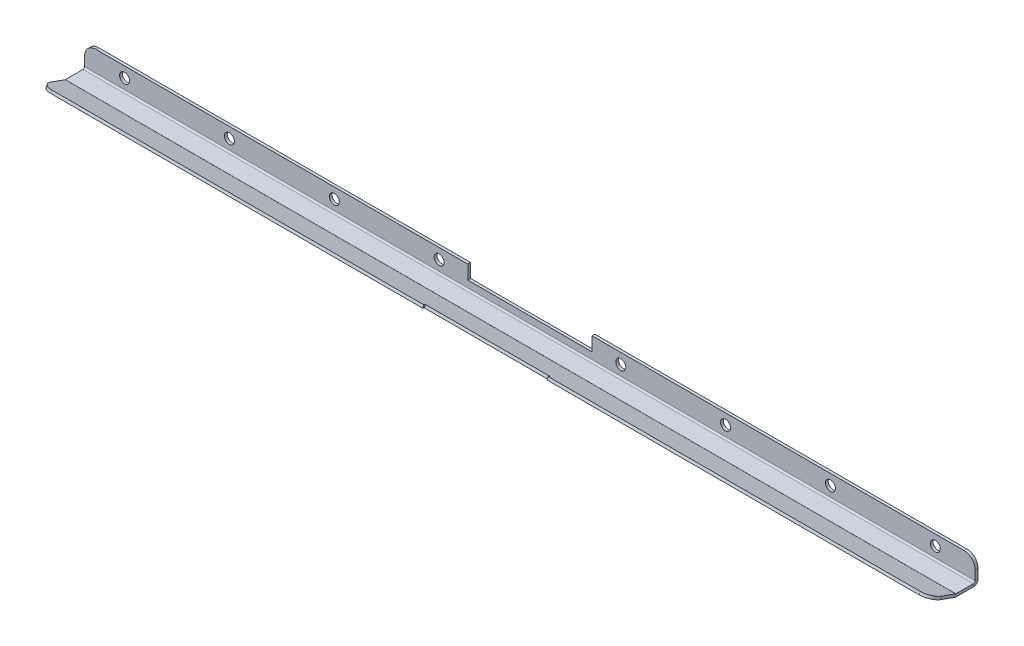
from build123d import *

# Parameters (mm, degrees)
SKETCH1_W                    = 1.25
SKETCH1_H                    = 10
BASE_FLANGE1_DEPTH           = 401
EDGE_FLANGE1_STRIP_W         = 6.4732
EDGE_FLANGE1_STRIP_H         = 1.25
EDGE_FLANGE1_STRIP_CUT_DEPTH = 401
EDGE_FLANGE1_DEPTH           = 401
EDGE_FLANGE2_STRIP_CUT_DEPTH = 401
EDGE_FLANGE2_DEPTH           = 401
CUT_EXTRUDE1_START           = 172.5
CUT_EXTRUDE1_OUTLINE_W       = 6.25
CUT_EXTRUDE1_OUTLINE_H       = 1.25
CUT_EXTRUDE1_DEPTH           = 56
SKETCH10_R                   = 2.25
CUT_EXTRUDE2_DEPTH           = 10
FILLET1_R                    = 5


# Read off the part's stored shape, not the designer's step: Cut-Extrude1
# Sheet-metal steps are written as plain solids
with BuildPart() as part:
    # Sketch1 → Base-Flange1 (new body)
    with BuildSketch(Plane(origin=(0, 0, 0), x_dir=(0, 0, -1), z_dir=(1, 0, 0))):
        with Locations((-0.625, 5)):
            Rectangle(SKETCH1_W, SKETCH1_H)
    extrude(amount=BASE_FLANGE1_DEPTH)

    # Edge-Flange1 strip (across the edge) → Edge-Flange1 strip cut (cut)
    with BuildSketch(Plane(origin=(0, 0, 1.25), x_dir=(0, 1, 0), z_dir=(1, 0, 0))):
        with Locations((-2.5, -0.625)):
            Rectangle(EDGE_FLANGE1_STRIP_W, EDGE_FLANGE1_STRIP_H)
    extrude(amount=EDGE_FLANGE1_STRIP_CUT_DEPTH, mode=Mode.SUBTRACT)

    # Edge-Flange1 section (across the edge) → Edge-Flange1 (add)
    with BuildSketch(Plane(origin=(0, 0, 1.25), x_dir=(0, 1, 0), z_dir=(1, 0, 0))):
        with BuildLine():
            Line((-1.25, 0.7366), (-1.25, 8.75))
            Line((-1.25, 8.75), (0, 8.75))
            Line((0, 8.75), (0, 0.7366))
            ThreePointArc((0, 0.7366), (0.215745145, 0.215745145), (0.7366, 0))
            Line((0.7366, 0), (0.7366, -1.25))
            ThreePointArc((0.7366, -1.25), (-0.668138332, -0.668138332), (-1.25, 0.7366))
        make_face()
    extrude(amount=EDGE_FLANGE1_DEPTH)

    # Edge-Flange2 strip (across the edge) → Edge-Flange2 strip cut (cut)
    with BuildSketch(Plane(origin=(0, 0, 10), x_dir=(0, 0.9396926207859113, -0.3420201433256607), z_dir=(1, 0, 0))):
        Polygon((-3.344158152, 5.53324351), (-1.13019336, -0.549574763), (0.044422416, -0.122049584), (-2.169542376, 5.960768689), align=None)
    extrude(amount=EDGE_FLANGE2_STRIP_CUT_DEPTH, mode=Mode.SUBTRACT)

    # Edge-Flange2 section (across the edge) → Edge-Flange2 (add)
    with BuildSketch(Plane(origin=(0, 0, 10), x_dir=(0, 0.9396926207859113, -0.3420201433256607), z_dir=(1, 0, 0))):
        with BuildLine():
            Line((-1.25, 0.129882454), (-1.25, 11.779591274))
            Line((-1.25, 11.779591274), (0, 11.779591274))
            Line((0, 11.779591274), (0, 0.129882454))
            ThreePointArc((0, 0.129882454), (0.011190609, 0.001973206), (0.044422416, -0.122049584))
            Line((0.044422416, -0.122049584), (-1.13019336, -0.549574763))
            ThreePointArc((-1.13019336, -0.549574763), (-1.219819082, -0.215087016), (-1.25, 0.129882454))
        make_face()
    extrude(amount=EDGE_FLANGE2_DEPTH)

    # Cut-Extrude1 outline → Cut-Extrude1 (cut)
    with BuildSketch(Plane.YZ.offset(CUT_EXTRUDE1_START)):
        Polygon((2.85424172, 21.496720175), (2.575384224, 20.730565502), (3.75, 20.303040323), (4.028857496, 21.069194996), align=None)
        with Locations((6.875, 0.625)):
            Rectangle(CUT_EXTRUDE1_OUTLINE_W, CUT_EXTRUDE1_OUTLINE_H)
    extrude(amount=CUT_EXTRUDE1_DEPTH, mode=Mode.SUBTRACT)

    # Sketch10 → Cut-Extrude2 (cut)
    with BuildSketch(Plane(origin=(0, 0, 0), x_dir=(-1, 0, 0), z_dir=(0, 0, -1))):
        with Locations(Location((-18, 5.25, 0), (0, 0, 90))):
            Circle(SKETCH10_R)
        with Locations(Location((-65.2, 5.25, 0), (0, 0, 90))):
            Circle(SKETCH10_R)
        with Locations(Location((-112.4, 5.25, 0), (0, 0, 90))):
            Circle(SKETCH10_R)
        with Locations(Location((-159.6, 5.25, 0), (0, 0, 90))):
            Circle(SKETCH10_R)
        with Locations(Location((-241.4, 5.25, 0), (0, 0, 90))):
            Circle(SKETCH10_R)
        with Locations(Location((-288.6, 5.25, 0), (0, 0, 90))):
            Circle(SKETCH10_R)
        with Locations(Location((-335.8, 5.25, 0), (0, 0, 90))):
            Circle(SKETCH10_R)
        with Locations(Location((-383, 5.25, 0), (0, 0, 90))):
            Circle(SKETCH10_R)
    extrude(amount=-CUT_EXTRUDE2_DEPTH, mode=Mode.SUBTRACT)

    # Fillet1
    fillet1_edges = [part.edges().sort_by_distance(p)[0] for p in [
        (401, 10, 0.625),
        (0, 10, 0.625),
        (0, 3.441549608, 21.282957586),
        (401, 3.441549608, 21.282957586),
    ]]
    fillet(fillet1_edges, radius=FILLET1_R)


solid = part.part
